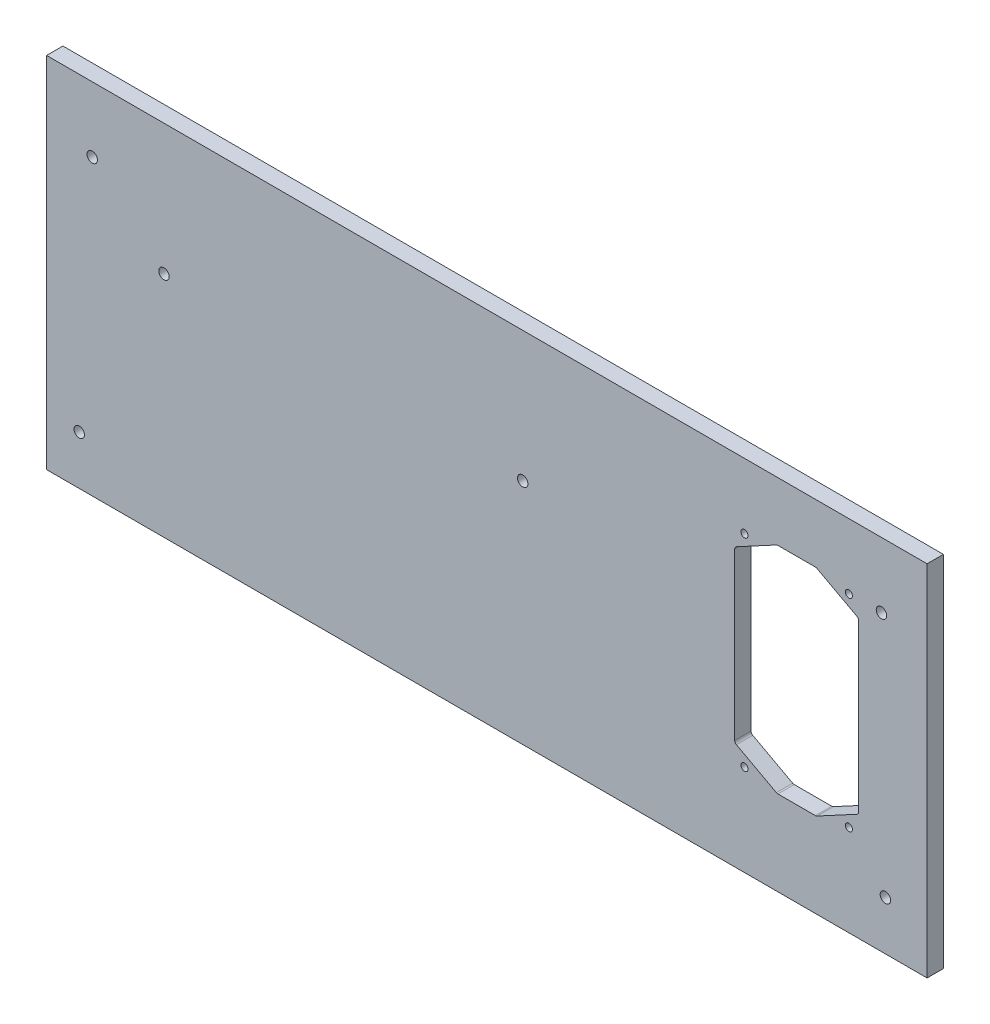
from build123d import *

# Parameters (mm, degrees)
SKETCH1_W                             = 270
SKETCH1_H                             = 110
BASE_DEPTH                            = 2.5
SKETCH4_R                             = 1.1
CUT_EXTRUDE1_DEPTH                    = 146.859521458
FILLET1_R                             = 1
F_3_2_3_2_MOUNTHOLES_D                = 3.2
F_3_2_3_2_MOUNTHOLES_CSINK_D          = 6.5
F_3_2_3_2_MOUNTHOLES_CSINK_ANGLE      = 90
F_3_2_3_2_MIDDLEPARTHOLES_D           = 3.2
F_3_2_3_2_MIDDLEPARTHOLES_CSINK_D     = 6.5
F_3_2_3_2_MIDDLEPARTHOLES_CSINK_ANGLE = 90


with BuildPart() as part:
    # Sketch1 → Base (new, symmetric)
    with BuildSketch(Plane.XY):
        Rectangle(SKETCH1_W, SKETCH1_H)
    extrude(amount=BASE_DEPTH, both=True)

    # Sketch4 → Cut-Extrude1 (cut, through all)
    with BuildSketch(Plane(origin=(0, 0, -2.5), x_dir=(-1, 0, 0), z_dir=(0, 0, -1))):
        with Locations((-79, 35)):
            Circle(SKETCH4_R)
        with Locations((-111, 35)):
            Circle(SKETCH4_R)
        with Locations((-111, -27)):
            Circle(SKETCH4_R)
        with Locations((-79, -27)):
            Circle(SKETCH4_R)
        Polygon((-101, 37), (-114, 30), (-114, -22), (-101, -29), (-89, -29), (-76, -22), (-76, 30), (-89, 37), align=None)
    extrude(amount=-CUT_EXTRUDE1_DEPTH, mode=Mode.SUBTRACT)

    # Fillet1
    fillet1_edges = [part.edges().sort_by_distance(p)[0] for p in [
        (76, 30, 0),
        (89, -29, 0),
        (101, -29, 0),
        (114, -22, 0),
        (114, 30, 0),
        (101, 37, 0),
        (89, 37, 0),
        (76, -22, 0),
    ]]
    fillet(fillet1_edges, radius=FILLET1_R)

    # Ø3.2 (3.2) MountHoles (through all)
    with Locations(Plane(origin=(0, 0, -2.5), x_dir=(-1, 0, 0), z_dir=(0, 0, -1))):
        with Locations((-121, 35), (-122.21675296, -40), (125, -40), (121, 35)):
            CounterSinkHole(F_3_2_3_2_MOUNTHOLES_D / 2, F_3_2_3_2_MOUNTHOLES_CSINK_D / 2, counter_sink_angle=F_3_2_3_2_MOUNTHOLES_CSINK_ANGLE)

    # Ø3.2 (3.2) MiddlePartHoles (through all)
    with Locations(Plane(origin=(0, 0, -2.5), x_dir=(-1, 0, 0), z_dir=(0, 0, -1))):
        with Locations((-11, 15), (99, 15)):
            CounterSinkHole(F_3_2_3_2_MIDDLEPARTHOLES_D / 2, F_3_2_3_2_MIDDLEPARTHOLES_CSINK_D / 2, counter_sink_angle=F_3_2_3_2_MIDDLEPARTHOLES_CSINK_ANGLE)


solid = part.part
